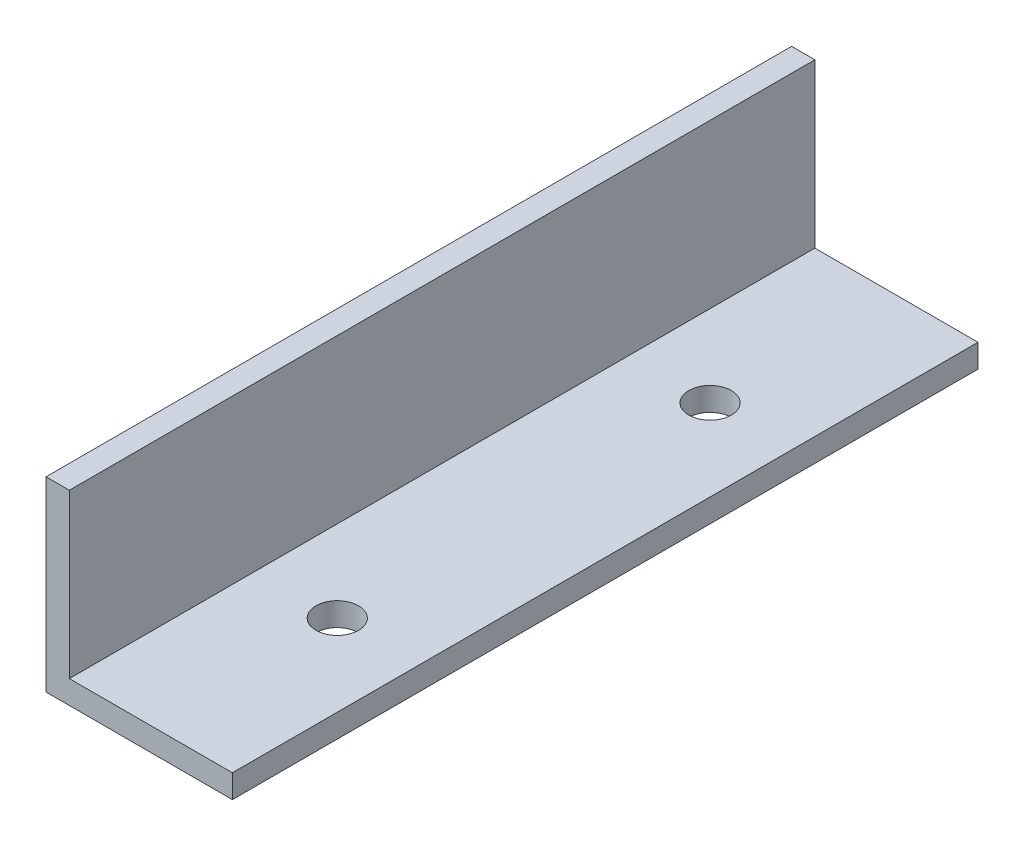
from build123d import *

# Parameters (mm, degrees)
BOSS_EXTRUDE1_DEPTH = 101.6
SKETCH2_R           = 2.9
CUT_EXTRUDE1_DEPTH  = 76.2


with BuildPart() as part:
    # Sketch1 → Boss-Extrude1 (new body)
    with BuildSketch(Plane.XY):
        Polygon((0, 0), (25.4, 0), (25.4, 3.175), (3.175, 3.175), (3.175, 25.4), (0, 25.4), align=None)
    extrude(amount=BOSS_EXTRUDE1_DEPTH)

    # Sketch2 → Cut-Extrude1 (cut)
    with BuildSketch(Plane(origin=(0, 0, 0), x_dir=(1, 0, 0), z_dir=(0, 1, 0))):
        with Locations((14.2875, -25.4)):
            Circle(SKETCH2_R)
        with Locations((14.2875, -76.2)):
            Circle(SKETCH2_R)
    extrude(amount=CUT_EXTRUDE1_DEPTH, mode=Mode.SUBTRACT)


solid = part.part
